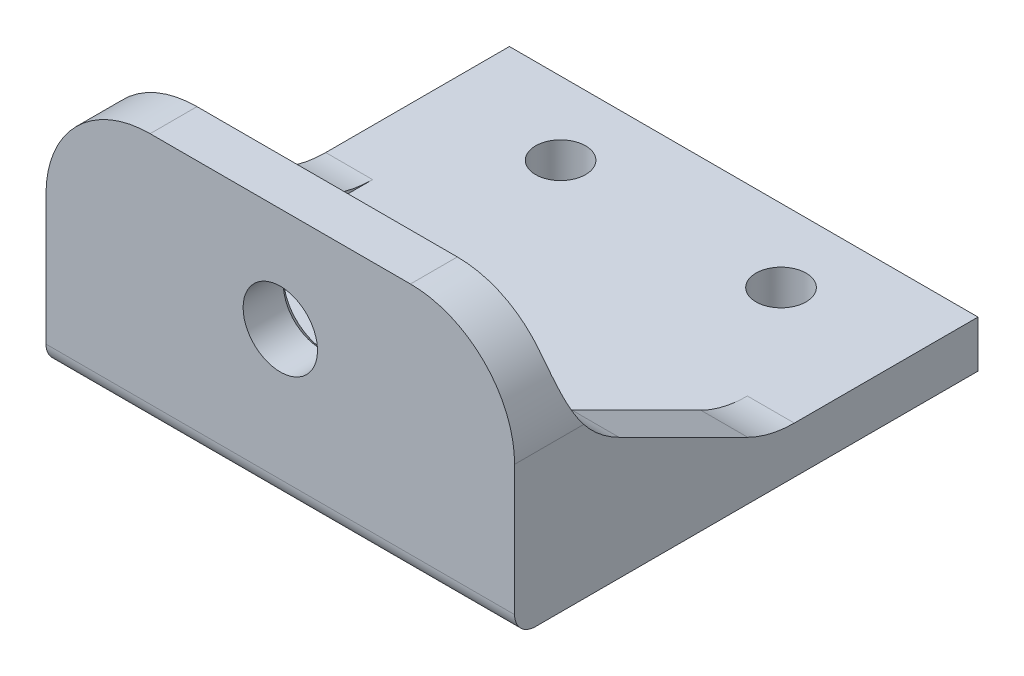
from build123d import *

# Parameters (mm, degrees)
BOSS_EXTRUDE1_DEPTH               = 4.5
M5_CLEARANCE_HOLE1_D              = 5.5
M5_CLEARANCE_HOLE1_CSINK_D        = 5.55
M5_CLEARANCE_HOLE1_CSINK_ANGLE    = 90
SKETCH5_R                         = 12.5
CUT_EXTRUDE1_DEPTH                = 81.825429167
SKETCH12_W                        = 45
SKETCH12_H                        = 24.5
BOSS_EXTRUDE2_DEPTH               = 4.5
F_1_4_CLEARANCE_HOLE1_D           = 7.14248
F_1_4_CLEARANCE_HOLE1_CSINK_D     = 8.41248
F_1_4_CLEARANCE_HOLE1_CSINK_ANGLE = 90
FILLET1_R                         = 10
FILLET2_R                         = 2
SKETCH18_W                        = 106.323058396
SKETCH18_H                        = 71.002809098
CUT_EXTRUDE4_DEPTH                = 60
M4_CLEARANCE_HOLE1_D              = 4.8
BOSS_EXTRUDE3_DEPTH               = 4.5
FILLET3_R                         = 10
FILLET3_OF_MIRROR1_R              = 10


with BuildPart() as part:
    # Sketch1 → Boss-Extrude1 (new body)
    with BuildSketch(Plane(origin=(0, 0, 0), x_dir=(1, 0, 0), z_dir=(0, 1, 0))):
        with BuildLine():
            Line((-22.5, -77.5), (22.5, -77.5))
            Line((22.5, -77.5), (22.5, 3.34e-07))
            ThreePointArc((22.5, 3.34e-07), (0, 22.5), (-22.5, 3.34e-07))
            Line((-22.5, 3.34e-07), (-22.5, -77.5))
        make_face()
    extrude(amount=BOSS_EXTRUDE1_DEPTH)

    # M5 Clearance Hole1 (through all)
    with Locations(Plane(origin=(0, 4.5, 0), x_dir=(1, 0, 0), z_dir=(0, 1, 0))):
        with Locations((-6.696960066, -16.167891819), (6.696960066, -16.167891819), (6.696960066, 16.167891819), (-6.696960066, 16.167891819)):
            CounterSinkHole(M5_CLEARANCE_HOLE1_D / 2, M5_CLEARANCE_HOLE1_CSINK_D / 2, counter_sink_angle=M5_CLEARANCE_HOLE1_CSINK_ANGLE)

    # Sketch5 → Cut-Extrude1 (cut, through all)
    with BuildSketch(Plane(origin=(0, 4.5, 0), x_dir=(1, 0, 0), z_dir=(0, 1, 0))):
        Circle(SKETCH5_R)
    extrude(amount=-CUT_EXTRUDE1_DEPTH, mode=Mode.SUBTRACT)

    # Sketch12 → Boss-Extrude2 (add)
    with BuildSketch(Plane.XY.offset(77.5)):
        with Locations((0, 12.25)):
            Rectangle(SKETCH12_W, SKETCH12_H)
    extrude(amount=BOSS_EXTRUDE2_DEPTH)

    # 1/4 Clearance Hole1 (through all)
    with Locations(Plane(origin=(0, 0, 77.5), x_dir=(-1, 0, 0), z_dir=(0, 0, -1))):
        with Locations((0, 14.5)):
            CounterSinkHole(F_1_4_CLEARANCE_HOLE1_D / 2, F_1_4_CLEARANCE_HOLE1_CSINK_D / 2, counter_sink_angle=F_1_4_CLEARANCE_HOLE1_CSINK_ANGLE)

    # Fillet1
    fillet1_edges = [part.edges().sort_by_distance(p)[0] for p in [
        (-22.5, 24.5, 79.75),
        (22.5, 24.5, 79.75),
    ]]
    fillet(fillet1_edges, radius=FILLET1_R)

    # Fillet2
    fillet2_edges = [part.edges().sort_by_distance(p)[0] for p in [
        (0, 0, 82),
        (0, 4.5, 77.5),
    ]]
    fillet(fillet2_edges, radius=FILLET2_R)

    # Sketch18 → Cut-Extrude4 (cut)
    with BuildSketch(Plane.XY.offset(-22.5)):
        with Locations((20.664180994, 31.016391908)):
            Rectangle(SKETCH18_W, SKETCH18_H)
    extrude(amount=CUT_EXTRUDE4_DEPTH, mode=Mode.SUBTRACT)

    # M4 Clearance Hole1 (through all)
    with Locations(Plane(origin=(0, 0, 0), x_dir=(-1, 0, 0), z_dir=(0, -1, 0))):
        with Locations((10.58478565, -44.5), (-10.58478565, -44.5)):
            Hole(M4_CLEARANCE_HOLE1_D / 2)

    # Sketch23 → Boss-Extrude3 (add)
    with BuildSketch(Plane.ZY.offset(22.5)):
        Polygon((77.5, 14.5), (57.5, 4.5), (77.5, 4.5), align=None)
    boss_extrude3 = extrude(amount=-BOSS_EXTRUDE3_DEPTH)

    # Fillet3
    fillet3_edges = [part.edges().sort_by_distance(p)[0] for p in [
        (-20.25, 4.5, 57.5),
        (-20.25, 14.5, 77.5),
    ]]
    fillet(fillet3_edges, radius=FILLET3_R)

    # Mirror1: Boss-Extrude3 across plane
    add(boss_extrude3.mirror(Plane(origin=(0, 0, 0), x_dir=(0, 0, 1), z_dir=(1, 0, 0))))

    # Fillet3 of Mirror1
    fillet3_of_mirror1_edges = [part.edges().sort_by_distance(p)[0] for p in [
        (20.25, 4.5, 57.5),
        (20.25, 14.5, 77.5),
    ]]
    fillet(fillet3_of_mirror1_edges, radius=FILLET3_OF_MIRROR1_R)


solid = part.part
